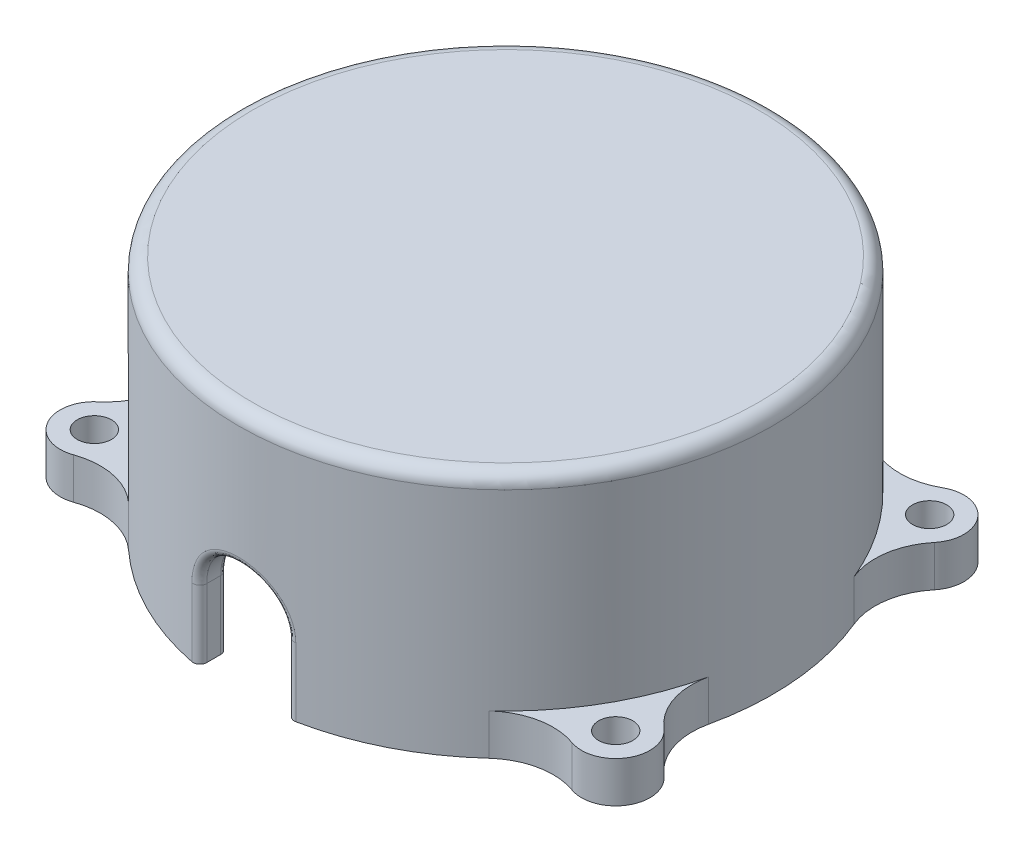
from build123d import *

# Parameters (mm, degrees)
SKETCH_2_R                  = 1.25
EXTRUDE_1491_DEPTH          = 3
FILLET_2_R                  = 3
FILLET_1631_R               = 5
CUT_EXTRUDE_2422_REACH      = 36.187
CUT_EXTRUDE_2422_END_RADIUS = 19.5
FILLET_4_R                  = 0.5
FILLET_5_R                  = 1


with BuildPart() as part:
    # Эскиз1 → Повернуть1 (revolve)
    with BuildSketch(Plane.XY):
        Polygon((0, 16), (0, 18), (19.5, 18), (19.5, 0), (17.5, 0), (17.5, 16), align=None)
    revolve(axis=Axis((0, 16, 0), (0, 1, 0)))

    # Эскиз2 → Extrude 1491 (add)
    # profile 1 of 4: a face of its own
    with BuildSketch(Plane.XZ):
        with BuildLine():
            Line((15.246008724, -16.056438521), (13.207625443, -14.346031861))
            ThreePointArc((13.207625443, -14.346031861), (14.937866641, -12.534358389), (16.421563491, -10.515809646))
            Line((16.421563491, -10.515809646), (18.459946773, -12.226216305))
            ThreePointArc((18.459946773, -12.226216305), (18.768088856, -15.748296437), (15.246008724, -16.056438521))
        make_face()
        with Locations(Location((16.852977749, -14.141327413, 0), (0, 0, 270))):
            Circle(SKETCH_2_R, mode=Mode.SUBTRACT)
    # profile 2 of 4: a face of its own
    with BuildSketch(Plane.XZ):
        with BuildLine():
            Line((-18.459946773, -12.226216305), (-16.421563491, -10.515809646))
            ThreePointArc((-16.421563491, -10.515809646), (-14.937866641, -12.534358389), (-13.207625443, -14.346031861))
            Line((-13.207625443, -14.346031861), (-15.246008724, -16.056438521))
            ThreePointArc((-15.246008724, -16.056438521), (-18.768088856, -15.748296437), (-18.459946773, -12.226216305))
        make_face()
        with Locations(Location((-16.852977749, -14.141327413, 0), (0, 0, 90))):
            Circle(SKETCH_2_R, mode=Mode.SUBTRACT)
    # profile 3 of 4: a face of its own
    with BuildSketch(Plane.XZ):
        with BuildLine():
            Line((17.802558883, 13.165063509), (15.498134224, 11.834603312))
            ThreePointArc((15.498134224, 11.834603312), (16.887495374, 9.75), (17.998134224, 7.504476293))
            Line((17.998134224, 7.504476293), (20.302558883, 8.834936491))
            ThreePointArc((20.302558883, 8.834936491), (21.217622393, 12.25), (17.802558883, 13.165063509))
        make_face()
        with Locations(Location((19.052558883, 11, 0), (0, 0, 270))):
            Circle(SKETCH_2_R, mode=Mode.SUBTRACT)
    # profile 4 of 4: a face of its own
    with BuildSketch(Plane.XZ):
        with BuildLine():
            Line((-20.302558883, 8.834936491), (-17.998134224, 7.504476293))
            ThreePointArc((-17.998134224, 7.504476293), (-16.887495374, 9.75), (-15.498134224, 11.834603312))
            Line((-15.498134224, 11.834603312), (-17.802558883, 13.165063509))
            ThreePointArc((-17.802558883, 13.165063509), (-21.217622393, 12.25), (-20.302558883, 8.834936491))
        make_face()
        with Locations(Location((-19.052558883, 11, 0), (0, 0, 90))):
            Circle(SKETCH_2_R, mode=Mode.SUBTRACT)
    extrude(amount=-EXTRUDE_1491_DEPTH)

    # Скругление2
    fillet_2_edges = [part.edges().sort_by_distance(p)[0] for p in [
        (-17.5, 16, 0),
    ]]
    fillet(fillet_2_edges, radius=FILLET_2_R)

    # Fillet 1631
    # the kernel refuses this fillet: 5 mm, written as the material it adds along each edge
    with BuildSketch(Plane(origin=(15.498134224, 0, 11.834603312), x_dir=(-0.6748484545014423, 0, 0.7379563425142538), z_dir=(0, 1, 0)), Plane(origin=(16.421563491, 0, -10.515809646), x_dir=(0.46264036439110967, 0, 0.8865460468785934), z_dir=(0, 1, 0)), Plane(origin=(-13.207625443, 0, -14.346031861), x_dir=(0.7927407641766817, 0, -0.6095589231670477), z_dir=(0, 1, 0)), Plane(origin=(-17.998134224, 0, 7.504476293), x_dir=(-0.301664712250469, 0, -0.9534140765600442), z_dir=(0, 1, 0))) as fillet_1631_piece_1:
        with BuildLine():
            CenterArc((3.893371259, 4.980387232), FILLET_1631_R, 202.918064629, 62.005438268)
            Line((-0.711942111, 3.033315388), (-1.172473448, 2.838608203))
            ThreePointArc((-1.172473448, 2.838608203), (-1.061572462, 2.490694934), (-0.488256583, -0.107728867))
            Line((-0.488256583, -0.107728867), (0.044242855, -0.498038723))
            ThreePointArc((0.044242855, -0.498038723), (1.725471354, -0.423510203), (3.406699852, -0.498038723))
            Line((3.406699852, -0.498038723), (3.450942707, 0))
        make_face()
    extrude(amount=3)
    with BuildSketch(Plane(origin=(17.998134224, 0, 7.504476293), x_dir=(0.3016647122504697, 0, -0.953414076560044), z_dir=(0, 1, 0)), Plane(origin=(13.207625443, 0, -14.346031861), x_dir=(-0.7927407641766814, 0, -0.609558923167048), z_dir=(0, 1, 0)), Plane(origin=(-16.421563491, 0, -10.515809646), x_dir=(-0.46264036439110884, 0, 0.886546046878594), z_dir=(0, 1, 0)), Plane(origin=(-15.498134224, 0, 11.834603312), x_dir=(0.674848454501442, 0, 0.7379563425142541), z_dir=(0, 1, 0))) as fillet_1631_piece_2:
        with BuildLine():
            CenterArc((3.893371259, -4.980387232), FILLET_1631_R, 95.076497103, 62.005438268)
            Line((-0.711942111, -3.033315388), (-1.172473448, -2.838608203))
            ThreePointArc((-1.172473448, -2.838608203), (-1.061572462, -2.490694934), (-0.488256583, 0.107728867))
            Line((-0.488256583, 0.107728867), (0.044242855, 0.498038723))
            ThreePointArc((0.044242855, 0.498038723), (1.725471354, 0.423510203), (3.406699852, 0.498038723))
            Line((3.406699852, 0.498038723), (3.450942707, 0))
        make_face()
    extrude(amount=3)

    # Cut-Extrude 2422: up to this cylinder (the profile starts inside it)
    cut_extrude_2422_end = Plane(origin=(0, 3.790585, 0), z_dir=(0, -1, 0)) * Cylinder(CUT_EXTRUDE_2422_END_RADIUS, 112.374, mode=Mode.PRIVATE)
    # Эскиз4 → Cut-Extrude 2422 (cut, up to the surface)
    with BuildSketch(Plane.XY, mode=Mode.PRIVATE) as cut_extrude_2422_sk1:
        with BuildLine():
            Line((-3.2, 5), (-3.2, 0))
            Line((-3.2, 0), (3.2, 0))
            Line((3.2, 0), (3.2, 5))
            ThreePointArc((3.2, 5), (0, 8.2), (-3.2, 5))
        make_face()
    cut_extrude_2422_tool1 = extrude(cut_extrude_2422_sk1.sketch, amount=CUT_EXTRUDE_2422_REACH, mode=Mode.PRIVATE) & cut_extrude_2422_end
    add(cut_extrude_2422_tool1.solids().sort_by_distance((0, 3.790585, 0))[0], mode=Mode.SUBTRACT)

    # Скругление4
    fillet_4_edges = [part.edges().sort_by_distance(p)[0] for p in [
        (1e-09, 8.200000026, 19.49999998),
        (-3.2, 2.5, 19.235643998),
        (3.2, 2.5, 19.235643998),
        (-3.2, 2.5, 17.204941151),
        (-3e-09, 8.200000027, 17.499999979),
        (3.2, 2.5, 17.204941151),
    ]]
    fillet(fillet_4_edges, radius=FILLET_4_R)

    # Скругление5
    fillet_5_edges = [part.edges().sort_by_distance(p)[0] for p in [
        (-19.5, 18, 0),
    ]]
    fillet(fillet_5_edges, radius=FILLET_5_R)


solid = part.part
